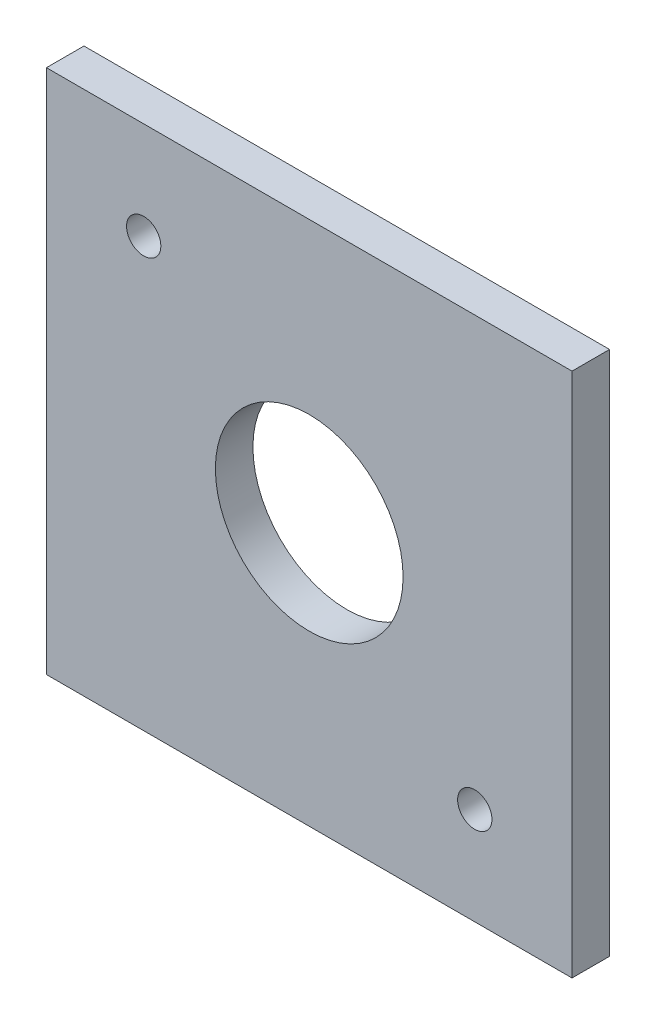
from build123d import *

# Parameters (mm, degrees)
SKETCH1_W              = 44.45
SKETCH1_H              = 44.45
BOSS_EXTRUDE1_DEPTH    = 3.175
M2_5_CLEARANCE_HOLE1_D = 2.9
SKETCH5_R              = 7.9375
CUT_EXTRUDE1_DEPTH     = 32.590851128


with BuildPart() as part:
    # Sketch1 → Boss-Extrude1 (new body)
    with BuildSketch(Plane.XY):
        Rectangle(SKETCH1_W, SKETCH1_H)
    extrude(amount=BOSS_EXTRUDE1_DEPTH)

    # M2.5 Clearance Hole1 (through all)
    with Locations(Plane.XY.offset(3.175)):
        with Locations((-14, 14), (14, -14)):
            Hole(M2_5_CLEARANCE_HOLE1_D / 2)

    # Sketch5 → Cut-Extrude1 (cut, through all)
    with BuildSketch(Plane.XY.offset(3.175)):
        Circle(SKETCH5_R)
    extrude(amount=-CUT_EXTRUDE1_DEPTH, mode=Mode.SUBTRACT)


solid = part.part
